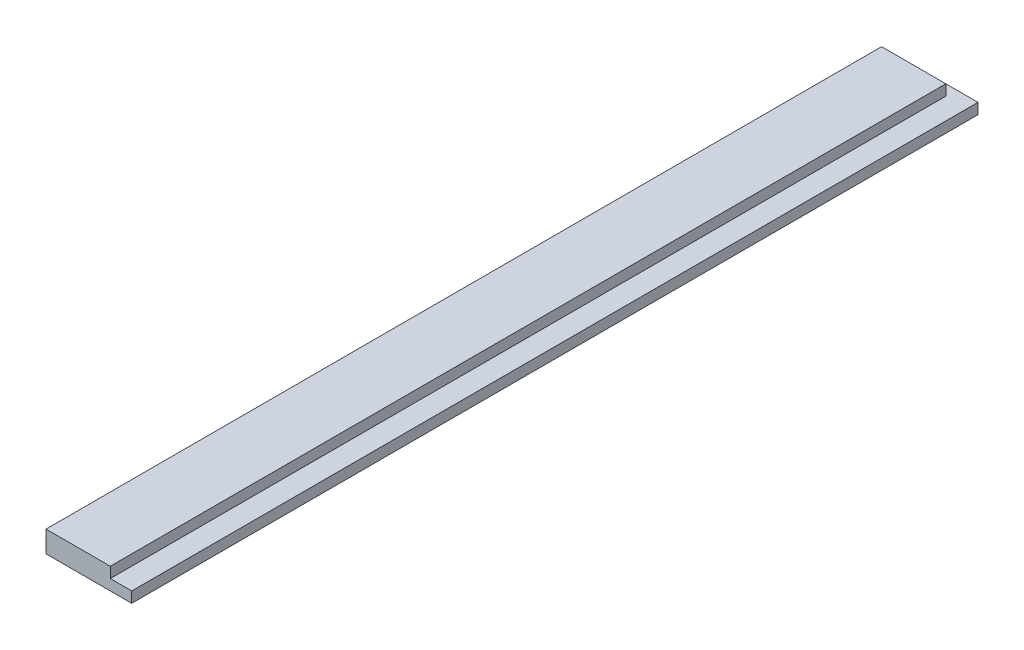
from build123d import *

# Parameters (mm, degrees)
BOSS_EXTRUDE1_DEPTH = 501.65
SKETCH3_W           = 38.1
SKETCH3_H           = 6.35
CUT_EXTRUDE1_DEPTH  = 6.35


with BuildPart() as part:
    # Sketch1 → Boss-Extrude1 (new body)
    with BuildSketch(Plane.XY):
        Polygon((0, 12.7), (38.1, 12.7), (38.1, 6.35), (50.8, 6.35), (50.8, 0), (0, 0), align=None)
    extrude(amount=BOSS_EXTRUDE1_DEPTH)

    # Sketch3 → Cut-Extrude1 (cut)
    with BuildSketch(Plane(origin=(0, 12.7, 0), x_dir=(1, 0, 0), z_dir=(0, 1, 0))):
        with Locations((19.05, -3.175)):
            Rectangle(SKETCH3_W, SKETCH3_H)
    extrude(amount=-CUT_EXTRUDE1_DEPTH, mode=Mode.SUBTRACT)


solid = part.part
